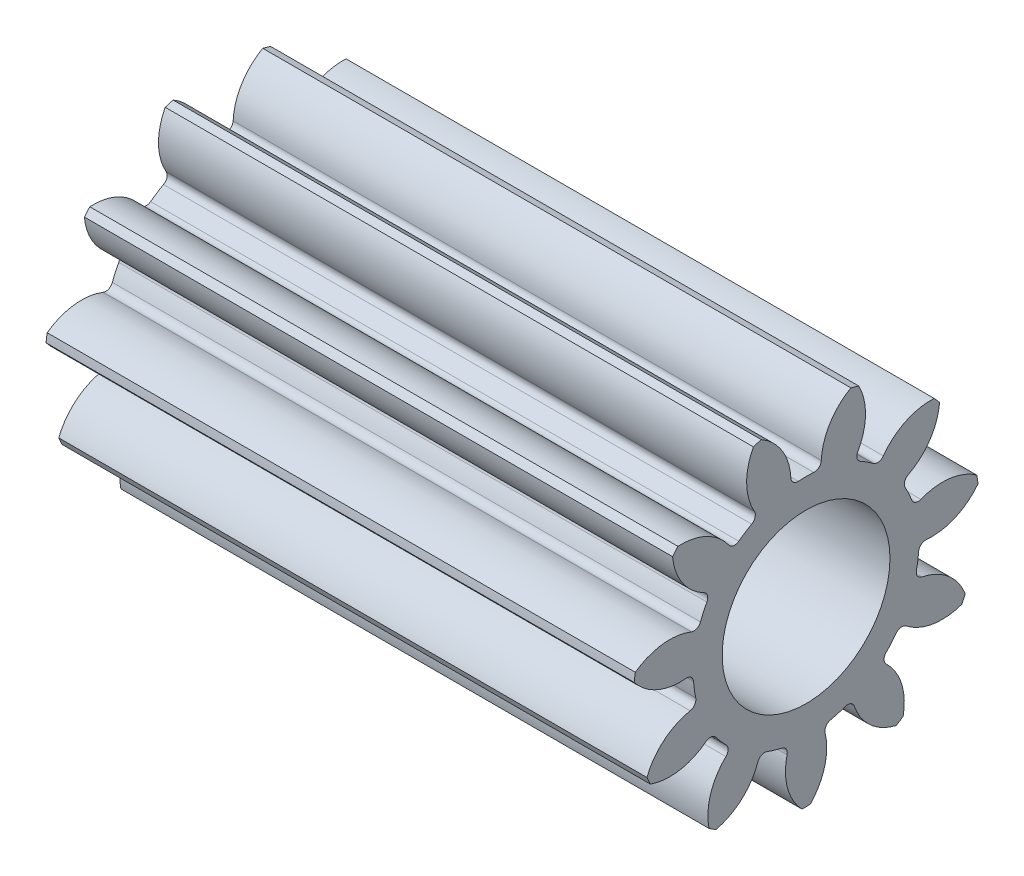
from build123d import *

# Parameters (mm, degrees)
BASPROSKE_W                = 17.526
BASPROSKE_H                = 5.159375
TOOTHCUT_DEPTH             = 19.984177011
ROOTFILLETS_R              = 0.20955
TEETHCUTS_COUNT            = 11
TEETHCUTS_ANGLE            = 327.272727273
ROOTFILLETS_OF_TEETHCUTS_R = 0.20955
CUT_EXTRUDE1_REACH         = 20.974
SKETCH1_R                  = 2.499999953


with BuildPart() as part:
    # BasProSke → Base-Revolve (revolve)
    with BuildSketch(Plane(origin=(0, 0, 0), x_dir=(1, 0, 0), z_dir=(0, 1, 0))):
        with Locations((8.763, 2.5796875)):
            Rectangle(BASPROSKE_W, BASPROSKE_H)
    revolve(axis=Axis((-10, 0, 0), (1, 0, 0)))

    # TooCutSke → ToothCut (cut, through all)
    with BuildSketch(Plane(origin=(0, 0, 0), x_dir=(0, 0, -1), z_dir=(1, 0, 0))):
        with BuildLine():
            ThreePointArc((0.455692995, 3.331302043), (0, 3.362325), (-0.455692995, 3.331302043))
            ThreePointArc((-0.455692995, 3.331302043), (-0.66414347, 4.301321709), (-1.3673759, 5.001217347))
            ThreePointArc((-1.3673759, 5.001217347), (0, 5.184775), (1.3673759, 5.001217347))
            ThreePointArc((1.3673759, 5.001217347), (0.66414347, 4.301321709), (0.455692995, 3.331302043))
        make_face()
    toothcut = extrude(amount=TOOTHCUT_DEPTH, mode=Mode.SUBTRACT)

    # RootFillets
    rootfillets_edges = [part.edges().sort_by_distance(p)[0] for p in [
        (8.763, 3.331302043, -0.455692995),
        (8.763, 3.331302043, 0.455692995),
    ]]
    fillet(rootfillets_edges, radius=ROOTFILLETS_R)

    # TeethCuts: ToothCut ×11 about axis
    teethcuts_axis = Axis((-10, 0, 0), (1, 0, 0))
    for i in range(1, TEETHCUTS_COUNT):
        add(toothcut.rotate(teethcuts_axis, i * TEETHCUTS_ANGLE / (TEETHCUTS_COUNT - 1)), mode=Mode.SUBTRACT)

    # RootFillets of TeethCuts
    rootfillets_of_teethcuts_edges = [part.edges().sort_by_distance(p)[0] for p in [
        (8.763, 3.048835846, 1.417684518),
        (8.763, 2.556103379, 2.184391201),
        (8.763, 1.798385809, 2.840957213),
        (8.763, 0.969359954, 3.219560636),
        (8.763, -0.023039015, 3.362246066),
        (8.763, -0.925148408, 3.232542317),
        (8.763, -1.837149114, 2.81604555),
        (8.763, -2.525928687, 2.219214652),
        (8.763, -3.067977351, 1.375770469),
        (8.763, -3.324744456, 0.501302016),
        (8.763, -3.324744456, -0.501302016),
        (8.763, -3.067977351, -1.375770469),
        (8.763, -2.525928687, -2.219214652),
        (8.763, -1.837149114, -2.81604555),
        (8.763, -0.925148408, -3.232542317),
        (8.763, -0.023039015, -3.362246066),
        (8.763, 0.969359954, -3.219560636),
        (8.763, 1.798385809, -2.840957213),
        (8.763, 2.556103379, -2.184391201),
        (8.763, 3.048835846, -1.417684518),
    ]]
    fillet(rootfillets_of_teethcuts_edges, radius=ROOTFILLETS_OF_TEETHCUTS_R)

    # Sketch1 → Cut-Extrude1 (cut, up to next)
    with BuildSketch(Plane(origin=(17.526, 0, 0), x_dir=(0, 0, -1), z_dir=(1, 0, 0)), mode=Mode.PRIVATE) as cut_extrude1_sk1:
        Circle(SKETCH1_R)
    cut_extrude1_tool1 = extrude(cut_extrude1_sk1.sketch, amount=-CUT_EXTRUDE1_REACH, mode=Mode.PRIVATE) & part.part
    add(cut_extrude1_tool1.solids().sort_by_distance((17.526, 0, 0))[0], mode=Mode.SUBTRACT)


solid = part.part
